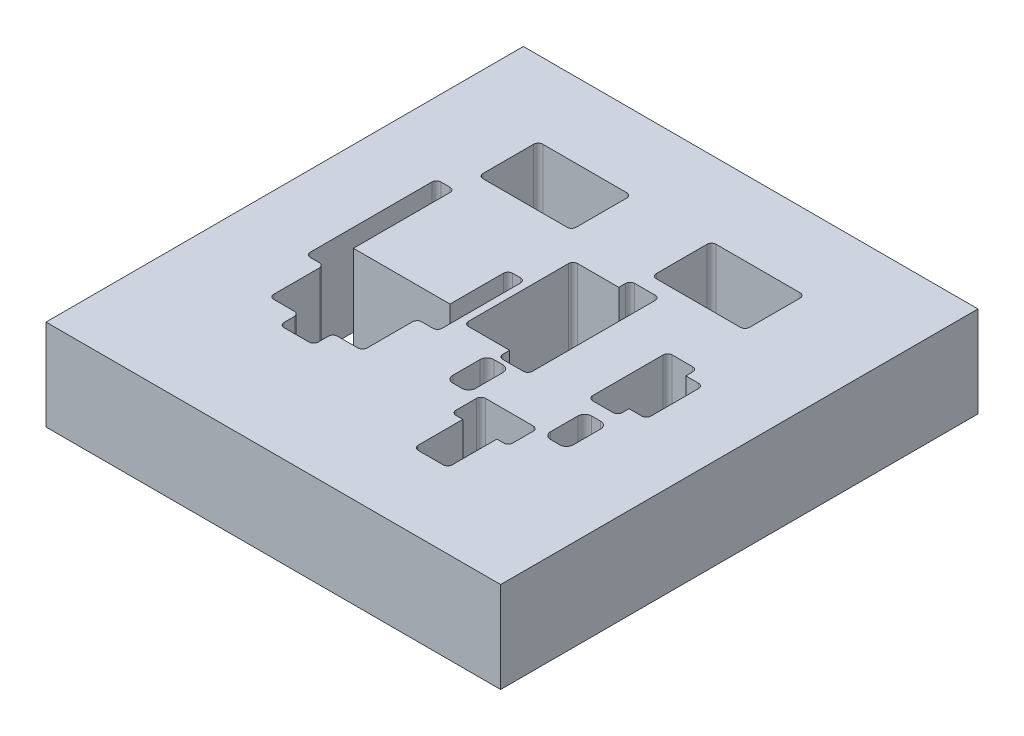
from build123d import *

# Parameters (mm, degrees)
SKETCH1_W           = 200
SKETCH1_H           = 210
BOSS_EXTRUDE1_DEPTH = 40
CUT_EXTRUDE2_REACH  = 152.416
FILLET3_R           = 2
CUT_EXTRUDE3_REACH  = 152.416
FILLET4_R           = 2
CUT_EXTRUDE4_REACH  = 152.416
FILLET5_R           = 2
CUT_EXTRUDE5_REACH  = 152.416
SKETCH6_W           = 41
SKETCH6_H           = 26.3
FILLET6_R           = 2
CUT_EXTRUDE6_REACH  = 152.416
CUT_EXTRUDE7_REACH  = 152.416
LPATTERN1_COUNT     = 2
LPATTERN1_PITCH     = 76.25
FILLET9_R           = 2
CUT_EXTRUDE10_REACH = 152.416
FILLET10_R          = 2


with BuildPart() as part:
    # Sketch1 → Boss-Extrude1 (new body)
    with BuildSketch(Plane(origin=(0, 0, 0), x_dir=(1, 0, 0), z_dir=(0, 1, 0))):
        Rectangle(SKETCH1_W, SKETCH1_H)
    extrude(amount=BOSS_EXTRUDE1_DEPTH)

    # Sketch3 → Cut-Extrude2 (cut, up to next)
    with BuildSketch(Plane(origin=(0, 40, 0), x_dir=(1, 0, 0), z_dir=(0, 1, 0)), mode=Mode.PRIVATE) as cut_extrude2_sk1:
        Polygon((28.75, -72.03), (43.75, -72.03), (43.75, -50.4), (48.75, -50.4), (48.75, -37.4), (23.75, -37.4), (23.75, -50.4), (28.75, -50.4), align=None)
    cut_extrude2_tool1 = extrude(cut_extrude2_sk1.sketch, amount=-CUT_EXTRUDE2_REACH, mode=Mode.PRIVATE) & part.part
    add(cut_extrude2_tool1.solids().sort_by_distance((36.25, 40, 52.550168))[0], mode=Mode.SUBTRACT)

    # Fillet3
    fillet3_edges = [part.edges().sort_by_distance(p)[0] for p in [
        (43.75, 20, 72.03),
        (28.75, 20, 72.03),
        (48.75, 20, 50.4),
        (23.75, 20, 50.4),
        (48.75, 20, 37.4),
        (23.75, 20, 37.4),
    ]]
    fillet(fillet3_edges, radius=FILLET3_R)

    # Sketch4 → Cut-Extrude3 (cut, up to next)
    with BuildSketch(Plane(origin=(0, 40, 0), x_dir=(1, 0, 0), z_dir=(0, 1, 0)), mode=Mode.PRIVATE) as cut_extrude3_sk1:
        Polygon((48.25, -14.77), (61.25, -14.77), (61.25, -9.77), (68.88, -9.77), (68.88, 15.23), (61.25, 15.23), (61.25, 20.23), (48.25, 20.23), align=None)
    cut_extrude3_tool1 = extrude(cut_extrude3_sk1.sketch, amount=-CUT_EXTRUDE3_REACH, mode=Mode.PRIVATE) & part.part
    add(cut_extrude3_tool1.solids().sort_by_distance((57.796978, 40, -2.73))[0], mode=Mode.SUBTRACT)

    # Fillet4
    fillet4_edges = [part.edges().sort_by_distance(p)[0] for p in [
        (68.88, 20, 9.77),
        (68.88, 20, -15.23),
        (61.25, 20, -20.23),
        (48.25, 20, -20.23),
        (48.25, 20, 14.77),
        (61.25, 20, 14.77),
    ]]
    fillet(fillet4_edges, radius=FILLET4_R)

    # Sketch5 → Cut-Extrude4 (cut, up to next)
    with BuildSketch(Plane(origin=(0, 40, 0), x_dir=(1, 0, 0), z_dir=(0, 1, 0)), mode=Mode.PRIVATE) as cut_extrude4_sk1:
        Polygon((-7.37, -13.77), (12.75, -13.77), (12.75, -18.77), (25.75, -18.77), (25.75, 39.23), (12.75, 39.23), (12.75, 34.23), (-7.37, 34.23), align=None)
    cut_extrude4_tool1 = extrude(cut_extrude4_sk1.sketch, amount=-CUT_EXTRUDE4_REACH, mode=Mode.PRIVATE) & part.part
    add(cut_extrude4_tool1.solids().sort_by_distance((9.950455, 40, -10.23))[0], mode=Mode.SUBTRACT)

    # Fillet5
    fillet5_edges = [part.edges().sort_by_distance(p)[0] for p in [
        (25.75, 20, -39.23),
        (12.75, 20, 18.77),
        (25.75, 20, 18.77),
        (-7.37, 20, 13.77),
        (12.75, 20, -39.23),
        (-7.37, 20, -34.23),
    ]]
    fillet(fillet5_edges, radius=FILLET5_R)

    # Sketch6 → Cut-Extrude5 (cut, up to next)
    with BuildSketch(Plane(origin=(0, 40, 0), x_dir=(1, 0, 0), z_dir=(0, 1, 0)), mode=Mode.PRIVATE) as cut_extrude5_sk1:
        with Locations((36.25, 58.88)):
            Rectangle(SKETCH6_W, SKETCH6_H)
    cut_extrude5_tool1 = extrude(cut_extrude5_sk1.sketch, amount=-CUT_EXTRUDE5_REACH, mode=Mode.PRIVATE) & part.part
    cut_extrude5 = cut_extrude5_tool1.solids().sort_by_distance((36.25, 40, -58.88))[0]
    add(cut_extrude5, mode=Mode.SUBTRACT)

    # Fillet6
    fillet6_edges = [part.edges().sort_by_distance(p)[0] for p in [
        (15.75, 20, -72.03),
        (56.75, 20, -72.03),
        (15.75, 20, -45.73),
        (56.75, 20, -45.73),
    ]]
    fillet(fillet6_edges, radius=FILLET6_R)

    # Sketch7 → Cut-Extrude6 (cut, up to next)
    with BuildSketch(Plane(origin=(0, 40, 0), x_dir=(1, 0, 0), z_dir=(0, 1, 0)), mode=Mode.PRIVATE) as cut_extrude6_sk1:
        with BuildLine():
            Line((59.75, -20.77), (55.75, -20.77))
            ThreePointArc((55.75, -20.77), (53.628679656, -21.648679656), (52.75, -23.77))
            Line((52.75, -23.77), (52.75, -35.77))
            ThreePointArc((52.75, -35.77), (53.628679656, -37.891320344), (55.75, -38.77))
            Line((55.75, -38.77), (59.75, -38.77))
            ThreePointArc((59.75, -38.77), (61.871320344, -37.891320344), (62.75, -35.77))
            Line((62.75, -35.77), (62.75, -23.77))
            ThreePointArc((62.75, -23.77), (61.871320344, -21.648679656), (59.75, -20.77))
        make_face()
    cut_extrude6_tool1 = extrude(cut_extrude6_sk1.sketch, amount=-CUT_EXTRUDE6_REACH, mode=Mode.PRIVATE) & part.part
    add(cut_extrude6_tool1.solids().sort_by_distance((57.75, 40, 29.77))[0], mode=Mode.SUBTRACT)

    # Sketch8 → Cut-Extrude7 (cut, up to next)
    with BuildSketch(Plane(origin=(0, 40, 0), x_dir=(1, 0, 0), z_dir=(0, 1, 0)), mode=Mode.PRIVATE) as cut_extrude7_sk1:
        with BuildLine():
            Line((12.75, -20.77), (16.75, -20.77))
            ThreePointArc((16.75, -20.77), (18.871320344, -21.648679656), (19.75, -23.77))
            Line((19.75, -23.77), (19.75, -35.77))
            ThreePointArc((19.75, -35.77), (18.871320344, -37.891320344), (16.75, -38.77))
            Line((16.75, -38.77), (12.75, -38.77))
            ThreePointArc((12.75, -38.77), (10.628679656, -37.891320344), (9.75, -35.77))
            Line((9.75, -35.77), (9.75, -23.77))
            ThreePointArc((9.75, -23.77), (10.628679656, -21.648679656), (12.75, -20.77))
        make_face()
    cut_extrude7_tool1 = extrude(cut_extrude7_sk1.sketch, amount=-CUT_EXTRUDE7_REACH, mode=Mode.PRIVATE) & part.part
    add(cut_extrude7_tool1.solids().sort_by_distance((14.75, 40, 29.77))[0], mode=Mode.SUBTRACT)

    # Cut-Sweep1: sweep along a path in Sketch10
    with BuildLine(Plane(origin=(0, 40, 0), x_dir=(1, 0, 0), z_dir=(0, 1, 0))) as cut_sweep1_path:
        Line((59.75, -20.77), (55.75, -20.77))
        ThreePointArc((55.75, -20.77), (53.628679656, -21.648679656), (52.75, -23.77))
        Line((52.75, -23.77), (52.75, -35.77))
        ThreePointArc((52.75, -35.77), (53.628679656, -37.891320344), (55.75, -38.77))
        Line((55.75, -38.77), (59.75, -38.77))
        ThreePointArc((59.75, -38.77), (61.871320344, -37.891320344), (62.75, -35.77))
        Line((62.75, -35.77), (62.75, -23.77))
        ThreePointArc((62.75, -23.77), (61.871320344, -21.648679656), (59.75, -20.77))
    # Sketch9 → Cut-Sweep1 (sweep, cut)
    with BuildSketch(Plane.XY.offset(29.77)):
        Polygon((62.75, 30), (63.273651948, 0), (62.75, 0), align=None)
    sweep(path=cut_sweep1_path.line, mode=Mode.SUBTRACT)

    # Cut-Sweep2: sweep along a path in Sketch14
    with BuildLine(Plane(origin=(0, 40, 0), x_dir=(1, 0, 0), z_dir=(0, 1, 0))) as cut_sweep2_path:
        Line((12.75, -38.77), (16.75, -38.77))
        ThreePointArc((16.75, -38.77), (18.871320344, -37.891320344), (19.75, -35.77))
        Line((19.75, -35.77), (19.75, -23.77))
        ThreePointArc((19.75, -23.77), (18.871320344, -21.648679656), (16.75, -20.77))
        Line((16.75, -20.77), (12.75, -20.77))
        ThreePointArc((12.75, -20.77), (10.628679656, -21.648679656), (9.75, -23.77))
        Line((9.75, -23.77), (9.75, -35.77))
        ThreePointArc((9.75, -35.77), (10.628679656, -37.891320344), (12.75, -38.77))
    # Sketch12 → Cut-Sweep2 (sweep, cut)
    with BuildSketch(Plane.XY.offset(29.77)):
        Polygon((19.75, 30), (20.273651948, 0), (19.75, 0), align=None)
    sweep(path=cut_sweep2_path.line, mode=Mode.SUBTRACT)

    # LPattern1: Cut-Extrude5 ×2
    with Locations(*[(-i * LPATTERN1_PITCH, 0, 0) for i in range(1, LPATTERN1_COUNT)]):
        add(cut_extrude5, mode=Mode.SUBTRACT)

    # Fillet9
    fillet9_edges = [part.edges().sort_by_distance(p)[0] for p in [
        (-60.5, 20, -45.73),
        (-19.5, 20, -45.73),
        (-19.5, 20, -72.03),
        (-60.5, 20, -72.03),
    ]]
    fillet(fillet9_edges, radius=FILLET9_R)

    # Sketch19 → Cut-Extrude10 (cut, up to next)
    with BuildSketch(Plane(origin=(0, 40, 0), x_dir=(1, 0, 0), z_dir=(0, 1, 0)), mode=Mode.PRIVATE) as cut_extrude10_sk1:
        Polygon((-47.5, -54.77), (-32.5, -54.77), (-32.5, -46.27), (-19.5, -46.27), (-19.5, -22.27), (-10.5, -22.27), (-10.5, 16.23), (-18, 16.23), (-18, -9.27), (-60.5, -9.27), (-60.5, 35.23), (-68.5, 35.23), (-68.5, -22.27), (-60.5, -22.27), (-60.5, -46.27), (-47.5, -46.27), align=None)
    cut_extrude10_tool1 = extrude(cut_extrude10_sk1.sketch, amount=-CUT_EXTRUDE10_REACH, mode=Mode.PRIVATE) & part.part
    add(cut_extrude10_tool1.solids().sort_by_distance((-41.417599, 40, 19.38333))[0], mode=Mode.SUBTRACT)

    # Fillet10
    fillet10_edges = [part.edges().sort_by_distance(p)[0] for p in [
        (-32.5, 20, 46.27),
        (-47.5, 20, 46.27),
        (-60.5, 20, 22.27),
        (-19.5, 20, 22.27),
        (-60.5, 20, 46.27),
        (-47.5, 20, 54.77),
        (-32.5, 20, 54.77),
        (-19.5, 20, 46.27),
        (-10.5, 20, 22.27),
        (-68.5, 20, 22.27),
        (-18, 20, -16.23),
        (-10.5, 20, -16.23),
        (-60.5, 20, -35.23),
        (-68.5, 20, -35.23),
    ]]
    fillet(fillet10_edges, radius=FILLET10_R)


solid = part.part
